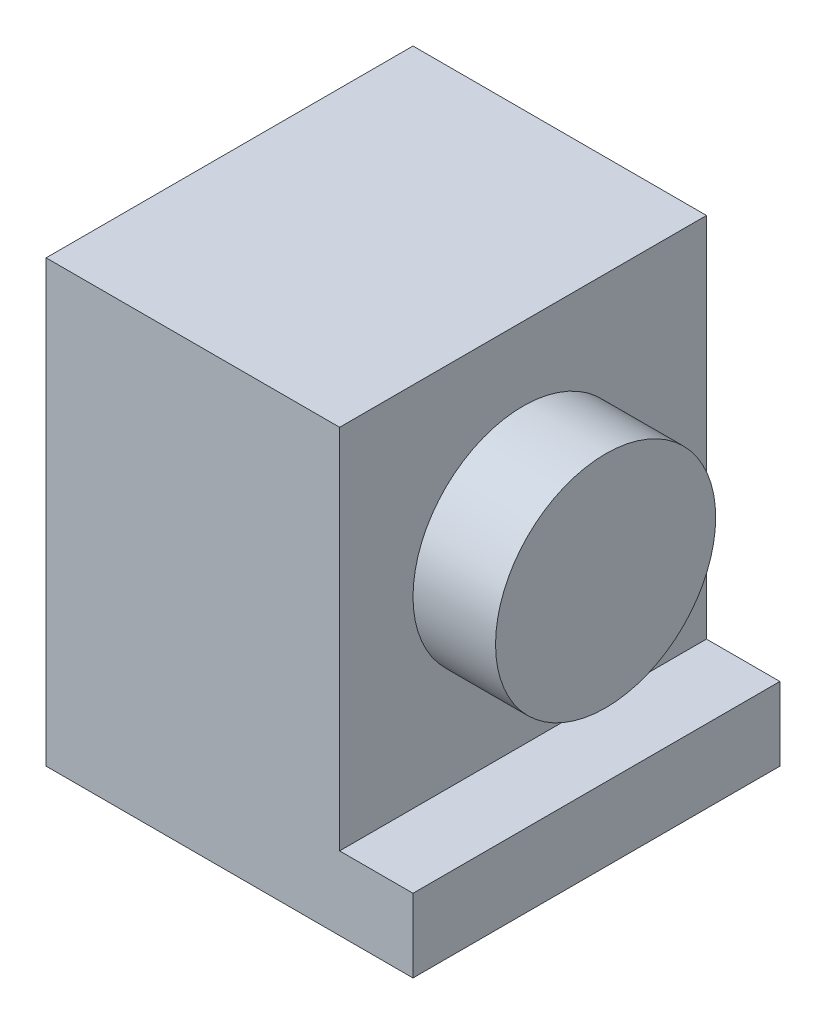
from build123d import *

# Parameters (mm, degrees)
SKETCH_1_W          = 8
SKETCH_1_H          = 8
EXTRUDE_1_DEPTH     = 9.6
SKETCH_2_W          = 1.6
SKETCH_2_H          = 8
CUT_EXTRUDE_1_DEPTH = 8
SKETCH_5_R          = 2.4
EXTRUDE_2_DEPTH     = 1.8


with BuildPart() as part:
    # Эскиз1 → Бобышка-Вытянуть1 (new body)
    with BuildSketch(Plane(origin=(0, 0, 0), x_dir=(1, 0, 0), z_dir=(0, 1, 0))):
        Rectangle(SKETCH_1_W, SKETCH_1_H)
    extrude(amount=EXTRUDE_1_DEPTH)

    # Эскиз2 → Вырез-Вытянуть1 (cut)
    with BuildSketch(Plane(origin=(0, 9.6, 0), x_dir=(1, 0, 0), z_dir=(0, 1, 0))):
        with Locations((3.2, 0)):
            Rectangle(SKETCH_2_W, SKETCH_2_H)
    extrude(amount=-CUT_EXTRUDE_1_DEPTH, mode=Mode.SUBTRACT)

    # Эскиз5 → Бобышка-Вытянуть2 (add)
    with BuildSketch(Plane(origin=(2.4, 0, 0), x_dir=(0, 0, -1), z_dir=(1, 0, 0))):
        with Locations((0, 5.6)):
            Circle(SKETCH_5_R)
    extrude(amount=EXTRUDE_2_DEPTH)


solid = part.part
